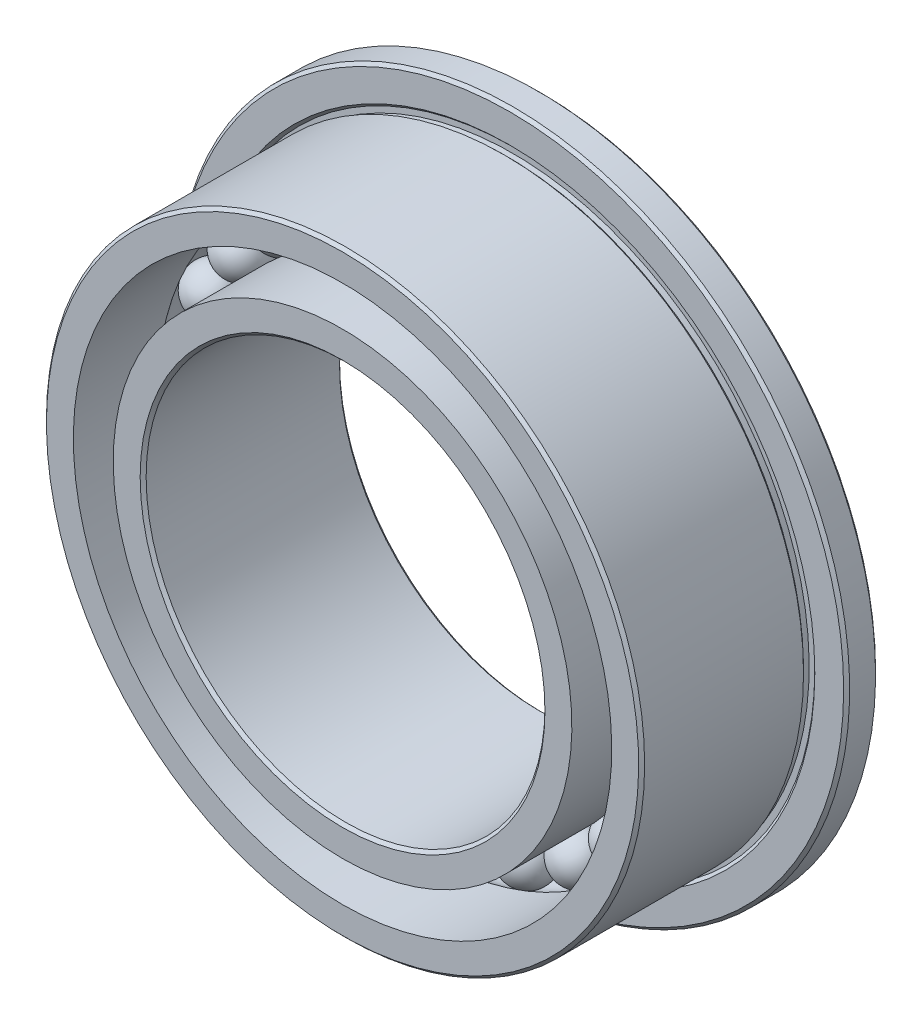
from build123d import *

# Parameters (mm, degrees)
FILLET1_SIZE      = 0.047625
FILLET2_SIZE      = 0.047625
CIRPATTERN3_COUNT = 27


with BuildPart() as part:
    # Sketch2 → Revolve1 (revolve)
    with BuildSketch(Plane(origin=(0, 0, 0), x_dir=(0, 0, -1), z_dir=(1, 0, 0)), mode=Mode.PRIVATE) as revolve1_sk:
        with BuildLine():
            Line((1.5875, 5.3594), (1.0795, 5.3594))
            Line((1.0795, 5.3594), (1.0795, 4.852302561))
            Line((1.0795, 4.852302561), (1.124401281, 4.807401281))
            Line((1.124401281, 4.807401281), (1.124401281, 4.717598719))
            Line((1.124401281, 4.717598719), (1.034598719, 4.717598719))
            Line((1.034598719, 4.717598719), (0.989697439, 4.7625))
            Line((0.989697439, 4.7625), (-1.5875, 4.7625))
            Line((-1.5875, 4.7625), (-1.5875, 4.28625))
            Line((-1.5875, 4.28625), (-0.238125, 4.28625))
            ThreePointArc((-0.238125, 4.28625), (0, 4.365625), (0.238125, 4.28625))
            Line((0.238125, 4.28625), (1.5875, 4.28625))
            Line((1.5875, 4.28625), (1.5875, 5.3594))
        make_face()
        with BuildLine():
            Line((1.5875, 3.175), (-1.5875, 3.175))
            Line((-1.5875, 3.175), (-1.5875, 3.65125))
            Line((-1.5875, 3.65125), (-0.238125, 3.65125))
            ThreePointArc((-0.238125, 3.65125), (0, 3.571875), (0.238125, 3.65125))
            Line((0.238125, 3.65125), (1.5875, 3.65125))
            Line((1.5875, 3.65125), (1.5875, 3.175))
        make_face()
    revolve(revolve1_sk.sketch.rotate(Axis((0, 0, 0), (0, 0, -1)), 180), axis=Axis((0, 0, 0), (0, 0, -1)))

    # Fillet1
    fillet1_edges = [part.edges().sort_by_distance(p)[0] for p in [
        (0, 4.7625, 1.5875),
        (0, 5.3594, -1.5875),
        (0, 5.3594, -1.0795),
    ]]
    chamfer(fillet1_edges, length=FILLET1_SIZE)

    # Fillet2
    fillet2_edges = [part.edges().sort_by_distance(p)[0] for p in [
        (0, 3.175, -1.5875),
        (0, 3.175, 1.5875),
    ]]
    chamfer(fillet2_edges, length=FILLET2_SIZE)


with BuildPart() as body_2:
    # Sketch7 → Revolve3 (revolve)
    with BuildSketch(Plane.XY):
        with BuildLine():
            Line((0, 4.365625), (0, 3.571875))
            ThreePointArc((0, 3.571875), (-0.396875, 3.96875), (0, 4.365625))
        make_face()
    revolve(axis=Axis((0, 4.365625, 0), (0, -1, 0)))


with BuildPart() as cirpattern3_1:
    # CirPattern3: pattern copy
    add(body_2.part.rotate(Axis((0, 0, 0), (0, 0, 1)), 1 * 360 / CIRPATTERN3_COUNT))


with BuildPart() as cirpattern3_2:
    # CirPattern3: pattern copy
    add(body_2.part.rotate(Axis((0, 0, 0), (0, 0, 1)), 2 * 360 / CIRPATTERN3_COUNT))


with BuildPart() as cirpattern3_3:
    # CirPattern3: pattern copy
    add(body_2.part.rotate(Axis((0, 0, 0), (0, 0, 1)), 3 * 360 / CIRPATTERN3_COUNT))


with BuildPart() as cirpattern3_4:
    # CirPattern3: pattern copy
    add(body_2.part.rotate(Axis((0, 0, 0), (0, 0, 1)), 4 * 360 / CIRPATTERN3_COUNT))


with BuildPart() as cirpattern3_5:
    # CirPattern3: pattern copy
    add(body_2.part.rotate(Axis((0, 0, 0), (0, 0, 1)), 5 * 360 / CIRPATTERN3_COUNT))


with BuildPart() as cirpattern3_6:
    # CirPattern3: pattern copy
    add(body_2.part.rotate(Axis((0, 0, 0), (0, 0, 1)), 6 * 360 / CIRPATTERN3_COUNT))


with BuildPart() as cirpattern3_7:
    # CirPattern3: pattern copy
    add(body_2.part.rotate(Axis((0, 0, 0), (0, 0, 1)), 7 * 360 / CIRPATTERN3_COUNT))


with BuildPart() as cirpattern3_8:
    # CirPattern3: pattern copy
    add(body_2.part.rotate(Axis((0, 0, 0), (0, 0, 1)), 8 * 360 / CIRPATTERN3_COUNT))


with BuildPart() as cirpattern3_9:
    # CirPattern3: pattern copy
    add(body_2.part.rotate(Axis((0, 0, 0), (0, 0, 1)), 9 * 360 / CIRPATTERN3_COUNT))


with BuildPart() as cirpattern3_10:
    # CirPattern3: pattern copy
    add(body_2.part.rotate(Axis((0, 0, 0), (0, 0, 1)), 10 * 360 / CIRPATTERN3_COUNT))


with BuildPart() as cirpattern3_11:
    # CirPattern3: pattern copy
    add(body_2.part.rotate(Axis((0, 0, 0), (0, 0, 1)), 11 * 360 / CIRPATTERN3_COUNT))


with BuildPart() as cirpattern3_12:
    # CirPattern3: pattern copy
    add(body_2.part.rotate(Axis((0, 0, 0), (0, 0, 1)), 12 * 360 / CIRPATTERN3_COUNT))


with BuildPart() as cirpattern3_13:
    # CirPattern3: pattern copy
    add(body_2.part.rotate(Axis((0, 0, 0), (0, 0, 1)), 13 * 360 / CIRPATTERN3_COUNT))


with BuildPart() as cirpattern3_14:
    # CirPattern3: pattern copy
    add(body_2.part.rotate(Axis((0, 0, 0), (0, 0, 1)), 14 * 360 / CIRPATTERN3_COUNT))


with BuildPart() as cirpattern3_15:
    # CirPattern3: pattern copy
    add(body_2.part.rotate(Axis((0, 0, 0), (0, 0, 1)), 15 * 360 / CIRPATTERN3_COUNT))


with BuildPart() as cirpattern3_16:
    # CirPattern3: pattern copy
    add(body_2.part.rotate(Axis((0, 0, 0), (0, 0, 1)), 16 * 360 / CIRPATTERN3_COUNT))


with BuildPart() as cirpattern3_17:
    # CirPattern3: pattern copy
    add(body_2.part.rotate(Axis((0, 0, 0), (0, 0, 1)), 17 * 360 / CIRPATTERN3_COUNT))


with BuildPart() as cirpattern3_18:
    # CirPattern3: pattern copy
    add(body_2.part.rotate(Axis((0, 0, 0), (0, 0, 1)), 18 * 360 / CIRPATTERN3_COUNT))


with BuildPart() as cirpattern3_19:
    # CirPattern3: pattern copy
    add(body_2.part.rotate(Axis((0, 0, 0), (0, 0, 1)), 19 * 360 / CIRPATTERN3_COUNT))


with BuildPart() as cirpattern3_20:
    # CirPattern3: pattern copy
    add(body_2.part.rotate(Axis((0, 0, 0), (0, 0, 1)), 20 * 360 / CIRPATTERN3_COUNT))


with BuildPart() as cirpattern3_21:
    # CirPattern3: pattern copy
    add(body_2.part.rotate(Axis((0, 0, 0), (0, 0, 1)), 21 * 360 / CIRPATTERN3_COUNT))


with BuildPart() as cirpattern3_22:
    # CirPattern3: pattern copy
    add(body_2.part.rotate(Axis((0, 0, 0), (0, 0, 1)), 22 * 360 / CIRPATTERN3_COUNT))


with BuildPart() as cirpattern3_23:
    # CirPattern3: pattern copy
    add(body_2.part.rotate(Axis((0, 0, 0), (0, 0, 1)), 23 * 360 / CIRPATTERN3_COUNT))


with BuildPart() as cirpattern3_24:
    # CirPattern3: pattern copy
    add(body_2.part.rotate(Axis((0, 0, 0), (0, 0, 1)), 24 * 360 / CIRPATTERN3_COUNT))


with BuildPart() as cirpattern3_25:
    # CirPattern3: pattern copy
    add(body_2.part.rotate(Axis((0, 0, 0), (0, 0, 1)), 25 * 360 / CIRPATTERN3_COUNT))


with BuildPart() as cirpattern3_26:
    # CirPattern3: pattern copy
    add(body_2.part.rotate(Axis((0, 0, 0), (0, 0, 1)), 26 * 360 / CIRPATTERN3_COUNT))


solid = Compound([part.part, body_2.part, cirpattern3_1.part, cirpattern3_2.part, cirpattern3_3.part, cirpattern3_4.part, cirpattern3_5.part, cirpattern3_6.part, cirpattern3_7.part, cirpattern3_8.part, cirpattern3_9.part, cirpattern3_10.part, cirpattern3_11.part, cirpattern3_12.part, cirpattern3_13.part, cirpattern3_14.part, cirpattern3_15.part, cirpattern3_16.part, cirpattern3_17.part, cirpattern3_18.part, cirpattern3_19.part, cirpattern3_20.part, cirpattern3_21.part, cirpattern3_22.part, cirpattern3_23.part, cirpattern3_24.part, cirpattern3_25.part, cirpattern3_26.part])
